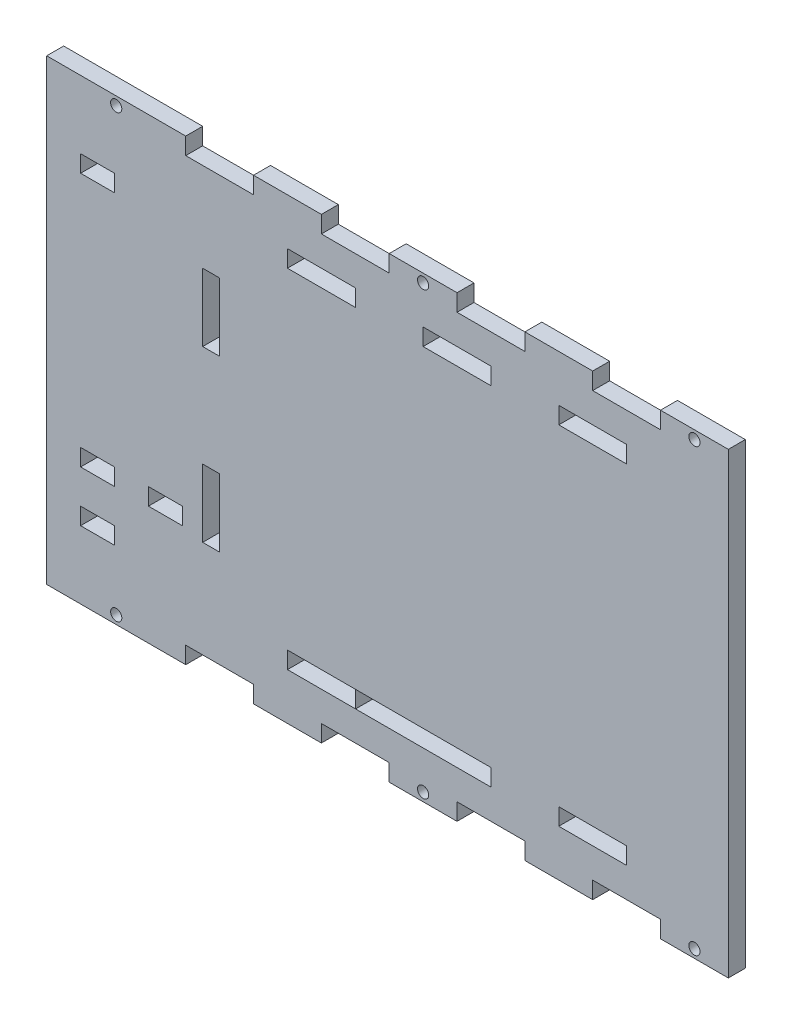
from build123d import *

# Parameters (mm, degrees)
SKETCH1_W           = 255.259874896
SKETCH1_H           = 171.45
BOSS_EXTRUDE1_DEPTH = 6.35
SKETCH2_W           = 25.4
SKETCH2_H           = 6.35
CUT_EXTRUDE1_DEPTH  = 6.35
LPATTERN1_COUNT     = 4
LPATTERN1_PITCH     = 50.8
SKETCH4_R           = 2.0955
CUT_EXTRUDE2_DEPTH  = 209.955242778
SKETCH5_W           = 25.4
SKETCH5_H           = 6.35
SKETCH5_W_2         = 50.690516307
SKETCH5_W_3         = 6.35
SKETCH5_H_2         = 25.4
CUT_EXTRUDE3_DEPTH  = 6.35
SKETCH6_W           = 12.7
SKETCH6_H           = 6.35
CUT_EXTRUDE4_DEPTH  = 6.35
SKETCH7_W           = 12.7
SKETCH7_H           = 6.35
SKETCH7_W_2         = 12.719718535
CUT_EXTRUDE5_DEPTH  = 6.35


with BuildPart() as part:
    # Sketch1 → Boss-Extrude1 (new body)
    with BuildSketch(Plane.XY):
        with Locations((-11.719947229, 69.85)):
            Rectangle(SKETCH1_W, SKETCH1_H)
    extrude(amount=BOSS_EXTRUDE1_DEPTH)

    # Sketch2 → Cut-Extrude1 (cut)
    with BuildSketch(Plane.XY.offset(6.35)):
        with Locations((-74.590009781, -12.7)):
            Rectangle(SKETCH2_W, SKETCH2_H)
        with Locations((-74.590009781, 152.4)):
            Rectangle(SKETCH2_W, SKETCH2_H)
    cut_extrude1 = extrude(amount=-CUT_EXTRUDE1_DEPTH, mode=Mode.SUBTRACT)

    # LPattern1: Cut-Extrude1 ×4
    with Locations(*[(i * LPATTERN1_PITCH, 0, 0) for i in range(1, LPATTERN1_COUNT)]):
        add(cut_extrude1, mode=Mode.SUBTRACT)

    # Sketch4 → Cut-Extrude2 (cut, through all)
    with BuildSketch(Plane(origin=(0, 0, 0), x_dir=(-1, 0, 0), z_dir=(0, 0, -1))):
        with Locations((-103.209990219, -12.7)):
            Circle(SKETCH4_R)
        with Locations((-1.609990219, -12.7)):
            Circle(SKETCH4_R)
        with Locations((113.319947229, -12.7)):
            Circle(SKETCH4_R)
        with Locations((113.319947229, 152.4)):
            Circle(SKETCH4_R)
        with Locations((-1.609990219, 152.4)):
            Circle(SKETCH4_R)
        with Locations((-103.209990219, 152.4)):
            Circle(SKETCH4_R)
    extrude(amount=-CUT_EXTRUDE2_DEPTH, mode=Mode.SUBTRACT)

    # Sketch5 → Cut-Extrude3 (cut)
    with BuildSketch(Plane(origin=(0, 0, 0), x_dir=(-1, 0, 0), z_dir=(0, 0, -1))):
        with Locations((-65.109990219, 4.7625)):
            Rectangle(SKETCH5_W, SKETCH5_H)
        with Locations((-1.664732066, 4.7625)):
            Rectangle(SKETCH5_W_2, SKETCH5_H)
        with Locations((36.490009781, 4.7625)):
            Rectangle(SKETCH5_W, SKETCH5_H)
        with Locations((77.765009781, 39.6875)):
            Rectangle(SKETCH5_W_3, SKETCH5_H_2)
        with Locations((77.765009781, 103.1875)):
            Rectangle(SKETCH5_W_3, SKETCH5_H_2)
        with Locations((36.490009781, 134.9375)):
            Rectangle(SKETCH5_W, SKETCH5_H)
        with Locations((-14.309990219, 134.9375)):
            Rectangle(SKETCH5_W, SKETCH5_H)
        with Locations((-65.109990219, 134.9375)):
            Rectangle(SKETCH5_W, SKETCH5_H)
    extrude(amount=-CUT_EXTRUDE3_DEPTH, mode=Mode.SUBTRACT)

    # Sketch6 → Cut-Extrude4 (cut)
    with BuildSketch(Plane.XY.offset(6.35)):
        with Locations((-120.299884677, 12.7)):
            Rectangle(SKETCH6_W, SKETCH6_H)
        with Locations((-120.299884677, 127)):
            Rectangle(SKETCH6_W, SKETCH6_H)
    extrude(amount=-CUT_EXTRUDE4_DEPTH, mode=Mode.SUBTRACT)

    # Sketch7 → Cut-Extrude5 (cut)
    with BuildSketch(Plane.XY.offset(6.35)):
        with Locations((-120.299884677, 31.75)):
            Rectangle(SKETCH7_W, SKETCH7_H)
        with Locations((-94.890025409, 31.75)):
            Rectangle(SKETCH7_W_2, SKETCH7_H)
    extrude(amount=-CUT_EXTRUDE5_DEPTH, mode=Mode.SUBTRACT)


solid = part.part
